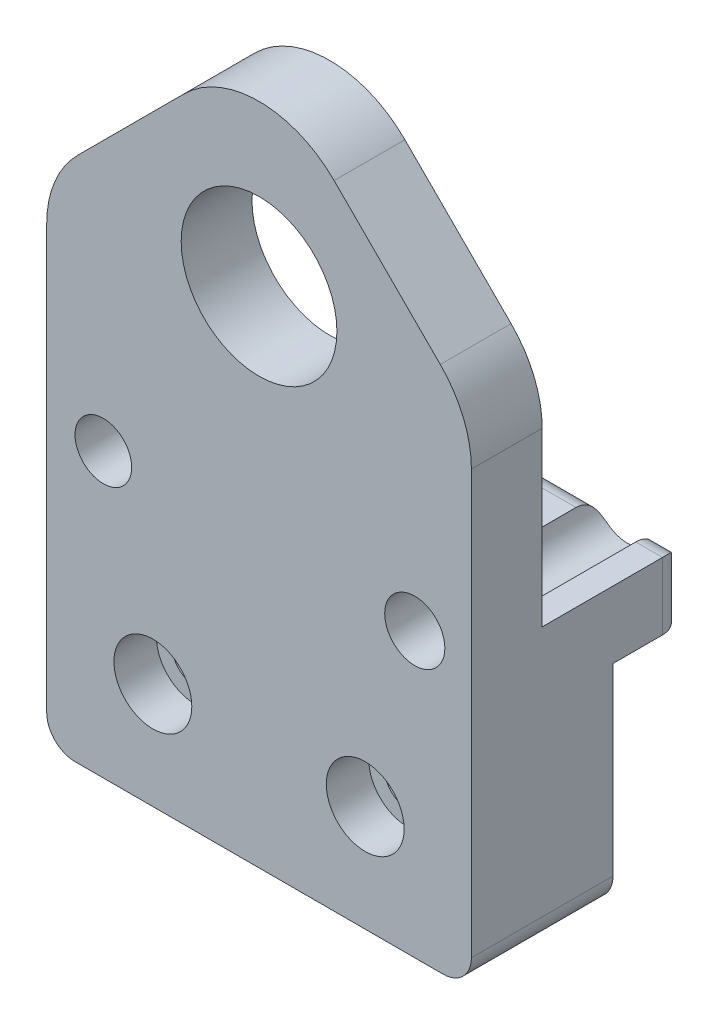
from build123d import *

# Parameters (mm, degrees)
ESBO_O2_R                         = 4
ESBO_O2_R_2                       = 4.25
ESBO_O2_R_3                       = 11
RESSALTO_EXTRUS_O1_DEPTH          = 20
RESSALTO_EXTRUS_O2_START          = 10
RESSALTO_EXTRUS_O2_DEPTH          = 10
FILETE1_R                         = 3
CORTE_EXTRUS_O1_DEPTH             = 10
REBAIXO_PARA_SHCS_M61_D           = 6.6
REBAIXO_PARA_SHCS_M61_CBORE_D     = 11
REBAIXO_PARA_SHCS_M61_CBORE_DEPTH = 6


with BuildPart() as part:
    # Esboço2 → Ressalto-extrusão1 (new body)
    with BuildSketch(Plane.XY):
        with BuildLine():
            Line((250, 102.212171493), (250, 76.212189341))
            ThreePointArc((250, 76.212189341), (248.828427125, 73.383762216), (246, 72.212189341))
            Line((246, 72.212189341), (194, 72.212189341))
            ThreePointArc((194, 72.212189341), (191.171572875, 73.383762216), (190, 76.212189341))
            Line((190, 76.212189341), (190, 102.212171493))
            Line((190, 102.212171493), (190, 135.998985905))
            ThreePointArc((190, 135.998985905), (191.141807012, 141.73923739), (194.393398282, 146.605587623))
            Line((194.393398282, 146.605587623), (209.393398282, 161.605587623))
            ThreePointArc((209.393398282, 161.605587623), (220, 165.998985905), (230.606601718, 161.605587623))
            Line((230.606601718, 161.605587623), (245.606601718, 146.605587623))
            ThreePointArc((245.606601718, 146.605587623), (248.858192988, 141.73923739), (250, 135.998985905))
            Line((250, 135.998985905), (250, 102.212171493))
        make_face()
        with Locations((198, 112.212189341)):
            Circle(ESBO_O2_R, mode=Mode.SUBTRACT)
        with Locations((242, 112.212189341)):
            Circle(ESBO_O2_R_2, mode=Mode.SUBTRACT)
        with Locations((220, 143.362189341)):
            Circle(ESBO_O2_R_3, mode=Mode.SUBTRACT)
    extrude(amount=RESSALTO_EXTRUS_O1_DEPTH)

    # Esboço3 → Ressalto-extrusão2 (add)
    with BuildSketch(Plane(origin=(0, 0, 0), x_dir=(-1, 0, 0), z_dir=(0, 0, -1)).offset(RESSALTO_EXTRUS_O2_START)):
        with BuildLine():
            Line((-250, 111.697903626), (-250, 102.212171493))
            Line((-250, 102.212171493), (-190, 102.212171493))
            Line((-190, 102.212171493), (-190, 111.697903626))
            Line((-190, 111.697903626), (-194.033198996, 111.697903626))
            ThreePointArc((-194.033198996, 111.697903626), (-198, 108.212189341), (-201.966801004, 111.697903626))
            Line((-201.966801004, 111.697903626), (-237.781231198, 111.697903626))
            ThreePointArc((-237.781231198, 111.697903626), (-242, 107.962189341), (-246.218768802, 111.697903626))
            Line((-246.218768802, 111.697903626), (-250, 111.697903626))
        make_face()
    extrude(amount=-RESSALTO_EXTRUS_O2_DEPTH)

    # Filete1
    filete1_edges = [part.edges().sort_by_distance(p)[0] for p in [
        (192.016599498, 111.697903626, -10),
        (248.109384401, 111.697903626, -10),
        (219.874016101, 111.697903626, -10),
        (250, 106.955037559, -10),
        (190, 106.955037559, -10),
    ]]
    fillet(filete1_edges, radius=FILETE1_R)

    # Esboço4 → Corte-extrusão1 (cut)
    with BuildSketch(Plane(origin=(0, 0, 0), x_dir=(-1, 0, 0), z_dir=(0, 0, -1))):
        with BuildLine():
            Line((-194.033198996, 111.697903626), (-190, 111.697903626))
            Line((-190, 111.697903626), (-190, 135.998985905))
            ThreePointArc((-190, 135.998985905), (-191.141807012, 141.73923739), (-194.393398282, 146.605587623))
            Line((-194.393398282, 146.605587623), (-209.393398282, 161.605587623))
            ThreePointArc((-209.393398282, 161.605587623), (-220, 165.998985905), (-230.606601718, 161.605587623))
            Line((-230.606601718, 161.605587623), (-245.606601718, 146.605587623))
            ThreePointArc((-245.606601718, 146.605587623), (-248.858192988, 141.73923739), (-250, 135.998985905))
            Line((-250, 135.998985905), (-250, 111.697903626))
            Line((-250, 111.697903626), (-246.218768802, 111.697903626))
            ThreePointArc((-246.218768802, 111.697903626), (-242, 116.462189341), (-237.781231198, 111.697903626))
            Line((-237.781231198, 111.697903626), (-201.966801004, 111.697903626))
            ThreePointArc((-201.966801004, 111.697903626), (-198, 116.212189341), (-194.033198996, 111.697903626))
        make_face()
    extrude(amount=-CORTE_EXTRUS_O1_DEPTH, mode=Mode.SUBTRACT)

    # Rebaixo para SHCS M61 (through all)
    with Locations(Plane.XY.offset(20)):
        with Locations((235, 87.212189341), (205, 87.212189341)):
            CounterBoreHole(REBAIXO_PARA_SHCS_M61_D / 2, REBAIXO_PARA_SHCS_M61_CBORE_D / 2, REBAIXO_PARA_SHCS_M61_CBORE_DEPTH)


solid = part.part
